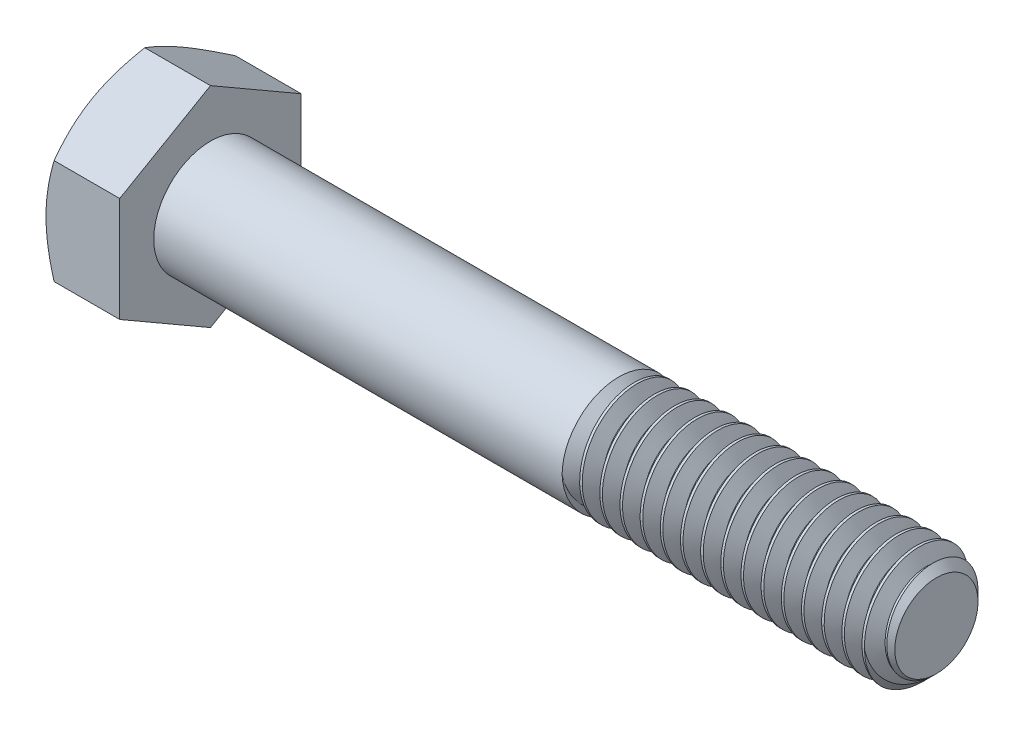
from build123d import *

# Parameters (mm, degrees)
SKETCH5_R           = 3.96875
BOSS_EXTRUDE3_DEPTH = 50.8
CHAMFER1_SIZE       = 1.058333333
CUT_SWEEP1_PITCH    = 1.411111111
BOSS_EXTRUDE4_DEPTH = 5.159375
SKETCH8_OUTSIDE_W   = 226.748
SKETCH8_OUTSIDE_H   = 228.712
SKETCH8_OUTSIDE_R   = 6.35
CUT_EXTRUDE3_DEPTH  = 57.79381564
CUT_EXTRUDE3_DRAFT  = -60
CUT_EXTRUDE4_DEPTH  = 0.254
CIRPATTERN1_COUNT   = 3


with BuildPart() as part:
    # Sketch5 → Boss-Extrude3 (new body)
    with BuildSketch(Plane(origin=(27.9796875, 0, 0), x_dir=(0, 0, -1), z_dir=(1, 0, 0))):
        Circle(SKETCH5_R)
    extrude(amount=-BOSS_EXTRUDE3_DEPTH)

    # Chamfer1
    chamfer1_edges = [part.edges().sort_by_distance(p)[0] for p in [
        (27.9796875, 0, 3.96875),
    ]]
    chamfer(chamfer1_edges, length=CHAMFER1_SIZE)

    # Cut-Sweep1: the profile of Sketch10 profile screwed along a right-hand helix of 16.75 turns, 8 arcs to a turn; built about Z, then put on its axis
    cut_sweep1_z = Axis((0, 0, 0), (0, 0, 1))
    cut_sweep1_corners = [(3.96905, 0, 0.000173205), (3.052206448, 0, -0.529166667), (3.052206448, 0, -0.705555556), (3.96905, 0, -1.234895427)]
    with BuildLine(mode=Mode.PRIVATE) as cut_sweep1_profile:
        Line(cut_sweep1_corners[0], cut_sweep1_corners[1])
        Line(cut_sweep1_corners[1], cut_sweep1_corners[2])
        Line(cut_sweep1_corners[2], cut_sweep1_corners[3])
        Line(cut_sweep1_corners[3], cut_sweep1_corners[0])
    cut_sweep1_cap = Face(cut_sweep1_profile.wire())
    cut_sweep1_turn_angles = [0, 22.5, 45, 67.5, 90, 112.5, 135, 157.5, 180, 202.5, 225, 247.5, 270, 292.5, 315, 337.5, 360]
    cut_sweep1_turn_weights = [1, 0.9238795325112867, 1, 0.9238795325112867, 1, 0.9238795325112867, 1, 0.9238795325112867, 1, 0.9238795325112867, 1, 0.9238795325112867, 1, 0.9238795325112867, 1, 0.9238795325112867, 1]
    cut_sweep1_turn_rails = [Edge.make_bspline([Vector(p[0], p[1], 0).rotate(cut_sweep1_z, cut_sweep1_turn_angles[k]) / cut_sweep1_turn_weights[k] + Vector(0, 0, p[2] + CUT_SWEEP1_PITCH * cut_sweep1_turn_angles[k] / 360) for k in range(17)], [0, 0, 0, 1, 1, 2, 2, 3, 3, 4, 4, 5, 5, 6, 6, 7, 7, 8, 8, 8], 2, cut_sweep1_turn_weights) for p in cut_sweep1_corners]
    cut_sweep1_turn_sides = [Face.make_surface_from_curves(cut_sweep1_turn_rails[p[0]], cut_sweep1_turn_rails[p[1]]) for p in [(0, 1), (1, 2), (2, 3), (3, 0)]]
    cut_sweep1_last_angles = [5760, 5782.5, 5805, 5827.5, 5850, 5872.5, 5895, 5917.5, 5940, 5962.5, 5985, 6007.5, 6030]
    cut_sweep1_last_weights = [1, 0.9238795325112867, 1, 0.9238795325112867, 1, 0.9238795325112867, 1, 0.9238795325112867, 1, 0.9238795325112867, 1, 0.9238795325112473, 1]
    cut_sweep1_last_rails = [Edge.make_bspline([Vector(p[0], p[1], 0).rotate(cut_sweep1_z, cut_sweep1_last_angles[k]) / cut_sweep1_last_weights[k] + Vector(0, 0, p[2] + CUT_SWEEP1_PITCH * cut_sweep1_last_angles[k] / 360) for k in range(13)], [0, 0, 0, 1, 1, 2, 2, 3, 3, 4, 4, 5, 5, 6, 6, 6], 2, cut_sweep1_last_weights) for p in cut_sweep1_corners]
    cut_sweep1_last_sides = [Face.make_surface_from_curves(cut_sweep1_last_rails[p[0]], cut_sweep1_last_rails[p[1]]) for p in [(0, 1), (1, 2), (2, 3), (3, 0)]]
    cut_sweep1 = Plane(origin=(27.9796875, 0, 0), x_dir=(0, 1, 0), z_dir=(-1, 0, 0)) * Solid(Shell([*[p.moved(Location((0, 0, CUT_SWEEP1_PITCH * i))) for i in range(16) for p in cut_sweep1_turn_sides], *cut_sweep1_last_sides, cut_sweep1_cap, cut_sweep1_cap.rotate(cut_sweep1_z, 6030).moved(Location((0, 0, CUT_SWEEP1_PITCH * 6030 / 360)))]))
    add(cut_sweep1, mode=Mode.SUBTRACT)

    # Sketch11 → Revolve1 (revolve)
    with BuildSketch(Plane.XY, mode=Mode.PRIVATE) as revolve1_sk:
        Polygon((-22.8203125, 3.96875), (-22.8203125, 0), (9.7234375, 0), (5.7546875, 3.96875), align=None)
    revolve(revolve1_sk.sketch.rotate(Axis((-22.8203125, 0, 0), (1, 0, 0)), 270), axis=Axis((-22.8203125, 0, 0), (1, 0, 0)))

    # Sketch6 → Boss-Extrude4 (add)
    with BuildSketch(Plane.ZY.offset(22.8203125)):
        Polygon((6.35, 3.666174209), (0, 7.332348419), (-6.35, 3.666174209), (-6.35, -3.666174209), (0, -7.332348419), (6.35, -3.666174209), align=None)
    extrude(amount=BOSS_EXTRUDE4_DEPTH)


with BuildPart() as cut_extrude3_tool:
    # Sketch8 outside → Cut-Extrude3 (with draft: the straight prism first)
    with BuildSketch(Plane.ZY.offset(27.9796875)):
        Rectangle(SKETCH8_OUTSIDE_W, SKETCH8_OUTSIDE_H)
        Circle(SKETCH8_OUTSIDE_R, mode=Mode.SUBTRACT)
    extrude(amount=-CUT_EXTRUDE3_DEPTH)
    # Cut-Extrude3: the draft: its side faces are tilted about the plane it starts from
    cut_extrude3_sides = [cut_extrude3_tool.faces().sort_by_distance(p)[0] for p in [
        (0.91722032, -114.356, 0),
        (0.91722032, 0, 113.374),
        (0.91722032, 114.356, 0),
        (0.91722032, 0, -113.374),
        (0.91722032, 0, -6.35),
    ]]
    draft(cut_extrude3_sides, Plane.ZY.offset(27.9796875), CUT_EXTRUDE3_DRAFT)


with BuildPart() as part_1:
    add(part.part)

    # Cut-Extrude3: cut by cut_extrude3_tool
    add(cut_extrude3_tool.part, mode=Mode.SUBTRACT)

    # Sketch12 → Cut-Extrude4 (cut)
    with BuildSketch(Plane.ZY.offset(27.9796875)):
        with BuildLine():
            Line((0.1905, 4.8895), (0.1905, 2.7305))
            ThreePointArc((0.1905, 2.7305), (0, 2.54), (-0.1905, 2.7305))
            Line((-0.1905, 2.7305), (-0.1905, 4.8895))
            ThreePointArc((-0.1905, 4.8895), (0, 5.08), (0.1905, 4.8895))
        make_face()
    cut_extrude4 = extrude(amount=-CUT_EXTRUDE4_DEPTH, mode=Mode.SUBTRACT)

    # CirPattern1: Cut-Extrude4 ×3 about axis
    cirpattern1_axis = Axis((0, 0, 0), (1, 0, 0))
    for i in range(1, CIRPATTERN1_COUNT):
        add(cut_extrude4.rotate(cirpattern1_axis, i * 360 / CIRPATTERN1_COUNT), mode=Mode.SUBTRACT)


solid = part_1.part
